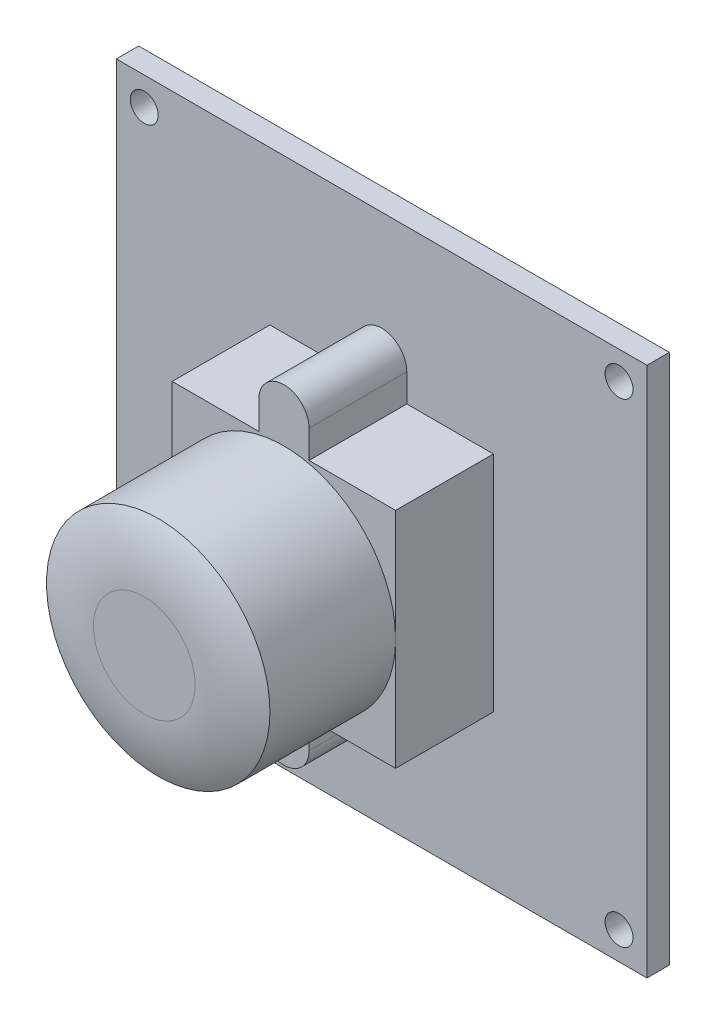
from build123d import *

# Parameters (mm, degrees)
ESQUISSE1_W        = 38
ESQUISSE1_H        = 38
ESQUISSE1_R        = 1
BOSS_EXTRU_1_DEPTH = 1.6
BOSS_EXTRU_2_DEPTH = 7
ESQUISSE3_R        = 8
BOSS_EXTRU_3_DEPTH = 10
CHANFREIN1_SIZE    = 1
CHANFREIN1_SIZE2   = 1.732050808
CONG_1_R           = 10
ESQUISSE4_W        = 6
ESQUISSE4_H        = 10
BOSS_EXTRU_4_DEPTH = 14


with BuildPart() as part:
    # Esquisse1 → Boss.-Extru.1 (new body)
    with BuildSketch(Plane.XY):
        with Locations((19, 19)):
            Rectangle(ESQUISSE1_W, ESQUISSE1_H)
        with Locations((2, 36)):
            Circle(ESQUISSE1_R, mode=Mode.SUBTRACT)
        with Locations((2, 2)):
            Circle(ESQUISSE1_R, mode=Mode.SUBTRACT)
        with Locations(Location((36, 2, 0), (0, 0, 180))):
            Circle(ESQUISSE1_R, mode=Mode.SUBTRACT)
        with Locations(Location((36, 36, 0), (0, 0, 180))):
            Circle(ESQUISSE1_R, mode=Mode.SUBTRACT)
    extrude(amount=BOSS_EXTRU_1_DEPTH)

    # Esquisse2 → Boss.-Extru.2 (add)
    with BuildSketch(Plane.XY.offset(1.6)):
        with BuildLine():
            Line((11, 27), (17.2, 27))
            Line((17.2, 27), (17.2, 29))
            ThreePointArc((17.2, 29), (19, 30.8), (20.8, 29))
            Line((20.8, 29), (20.8, 27))
            Line((20.8, 27), (27, 27))
            Line((27, 27), (27, 11))
            Line((27, 11), (20.8, 11))
            Line((20.8, 11), (20.8, 9))
            ThreePointArc((20.8, 9), (19, 7.2), (17.2, 9))
            Line((17.2, 9), (17.2, 11))
            Line((17.2, 11), (11, 11))
            Line((11, 11), (11, 27))
        make_face()
    extrude(amount=BOSS_EXTRU_2_DEPTH)

    # Esquisse3 → Boss.-Extru.3 (add)
    with BuildSketch(Plane.XY.offset(8.6)):
        with Locations((19, 19)):
            Circle(ESQUISSE3_R)
    extrude(amount=BOSS_EXTRU_3_DEPTH)

    # Chanfrein1
    chanfrein1_edges = [part.edges().sort_by_distance(p)[0] for p in [
        (11, 19, 18.6),
    ]]
    chanfrein1_side = [part.faces().sort_by_distance(p)[0] for p in [
        (11, 19, 13.6),
    ]]
    chamfer(chanfrein1_edges, length=CHANFREIN1_SIZE, length2=CHANFREIN1_SIZE2, reference=chanfrein1_side[0])

    # Congé1
    # the kernel refuses this fillet: 10 mm, written as the material it takes off along each edge
    with BuildSketch(Plane(origin=(19, 19, 18.6), x_dir=(1, 0, 0), z_dir=(0, -1, 0))) as cong_1_piece_1:
        with BuildLine():
            CenterArc((3.641101056, -10), CONG_1_R, 64.158067237, 25.841932763)
            Line((3.641101056, 0), (3.641101056, 0.2))
            Line((3.641101056, 0.2), (6.267949192, 0.2))
            Line((6.267949192, 0.2), (6.367949192, 0.173205081))
            ThreePointArc((6.367949192, 0.173205081), (7.233974596, -0.326794919), (8.087177979, -0.82))
            Line((8.087177979, -0.82), (8, -1))
        make_face()
    revolve(axis=Axis((19, 19, 18.6), (0, 0, 1)), mode=Mode.SUBTRACT)

    # Esquisse4 → Boss.-Extru.4 (add)
    with BuildSketch(Plane(origin=(0, 0, 0), x_dir=(-1, 0, 0), z_dir=(0, 0, -1))):
        with Locations((-3, 16)):
            Rectangle(ESQUISSE4_W, ESQUISSE4_H)
    extrude(amount=BOSS_EXTRU_4_DEPTH)


solid = part.part
